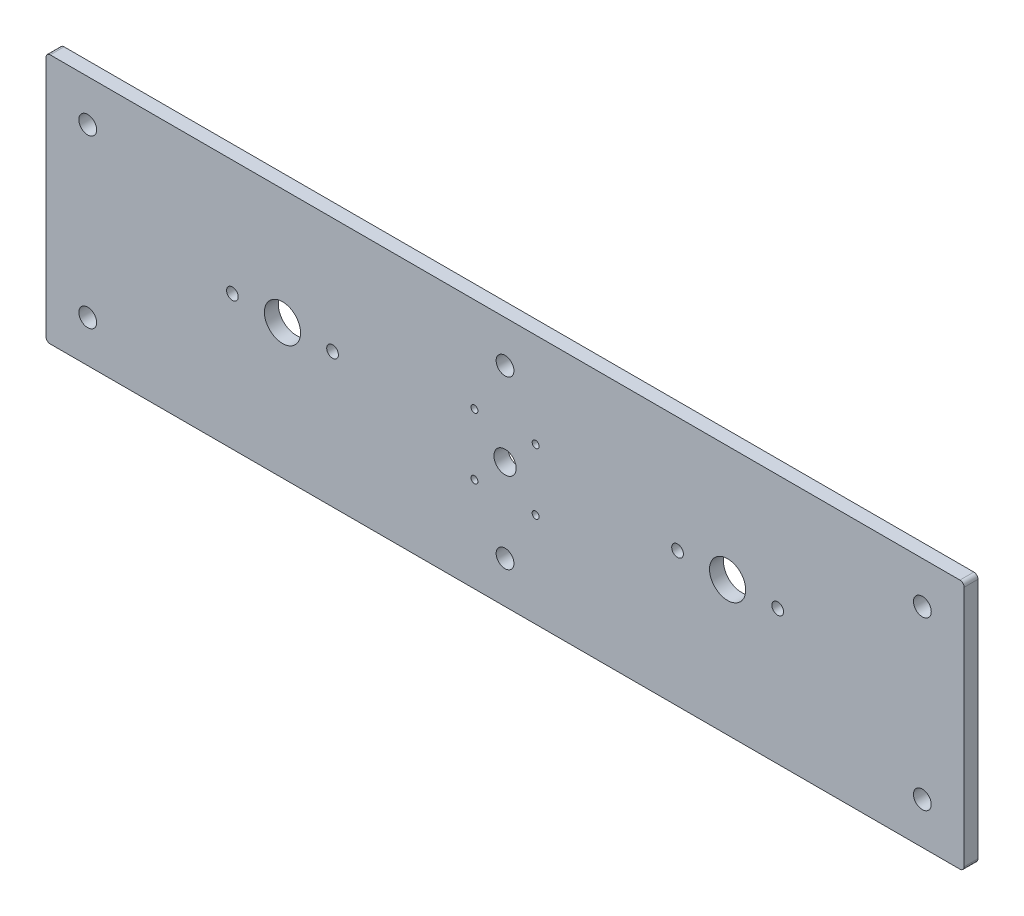
from build123d import *

# Parameters (mm, degrees)
SKETCH1_W                = 330
SKETCH1_H                = 90
BOSS_EXTRUDE1_DEPTH      = 2.5
M6_CLEARANCE_HOLE1_D     = 6.4
M6_CLEARANCE_HOLE1_DEPTH = 10
M6_CLEARANCE_HOLE1_TIP   = 1.922753981
SKETCH3_R                = 6.5
CUT_EXTRUDE2_DEPTH       = 172.099386323
M5X0_8_TAPPED_HOLE1_D    = 4.2
SKETCH4_R                = 4
CUT_EXTRUDE3_DEPTH       = 172.099386323
M3X0_5_TAPPED_HOLE1_D    = 2.5
FILLET1_R                = 1.5


with BuildPart() as part:
    # Sketch1 → Boss-Extrude1 (new, symmetric)
    with BuildSketch(Plane.XY):
        Rectangle(SKETCH1_W, SKETCH1_H)
    extrude(amount=BOSS_EXTRUDE1_DEPTH, both=True)

    # M6 Clearance Hole1
    with Locations(Plane.XY.offset(2.5)):
        with Locations((-150, 30), (-150, -30), (0, 30), (0, -30), (150, -30), (150, 30)):
            Hole(M6_CLEARANCE_HOLE1_D / 2, depth=M6_CLEARANCE_HOLE1_DEPTH)
            with Locations((0, 0, -(M6_CLEARANCE_HOLE1_DEPTH + M6_CLEARANCE_HOLE1_TIP / 2))):  # 118° drill point
                Cone(0, M6_CLEARANCE_HOLE1_D / 2, M6_CLEARANCE_HOLE1_TIP, mode=Mode.SUBTRACT)

    # Sketch3 → Cut-Extrude2 (cut, through all)
    with BuildSketch(Plane.XY.offset(2.5)):
        with Locations((-80, 3.4)):
            Circle(SKETCH3_R)
    cut_extrude2 = extrude(amount=-CUT_EXTRUDE2_DEPTH, mode=Mode.SUBTRACT)

    # M5x0.8 Tapped Hole1 (through all)
    with Locations(Plane.XY.offset(2.5)):
        with Locations((-98, 3.4), (-62, 3.4)):
            m5x0_8_tapped_hole1 = Hole(M5X0_8_TAPPED_HOLE1_D / 2)

    # Mirror1: Cut-Extrude2, M5x0.8 Tapped Hole1 across plane
    add(cut_extrude2.mirror(Plane(origin=(0, 0, 0), x_dir=(0, 0, 1), z_dir=(1, 0, 0))), mode=Mode.SUBTRACT)
    add(m5x0_8_tapped_hole1.mirror(Plane(origin=(0, 0, 0), x_dir=(0, 0, 1), z_dir=(1, 0, 0))), mode=Mode.SUBTRACT)

    # Sketch4 → Cut-Extrude3 (cut, through all)
    with BuildSketch(Plane.XY.offset(2.5)):
        Circle(SKETCH4_R)
    extrude(amount=-CUT_EXTRUDE3_DEPTH, mode=Mode.SUBTRACT)

    # M3x0.5 Tapped Hole1 (through all)
    with Locations(Plane.XY.offset(2.5)):
        with Locations((11, 11), (-11, -11), (-11, 11), (11, -11)):
            Hole(M3X0_5_TAPPED_HOLE1_D / 2)

    # Fillet1
    fillet1_edges = [part.edges().sort_by_distance(p)[0] for p in [
        (-165, -45, 0),
        (-165, 45, 0),
        (165, -45, 0),
        (165, 45, 0),
    ]]
    fillet(fillet1_edges, radius=FILLET1_R)


solid = part.part
